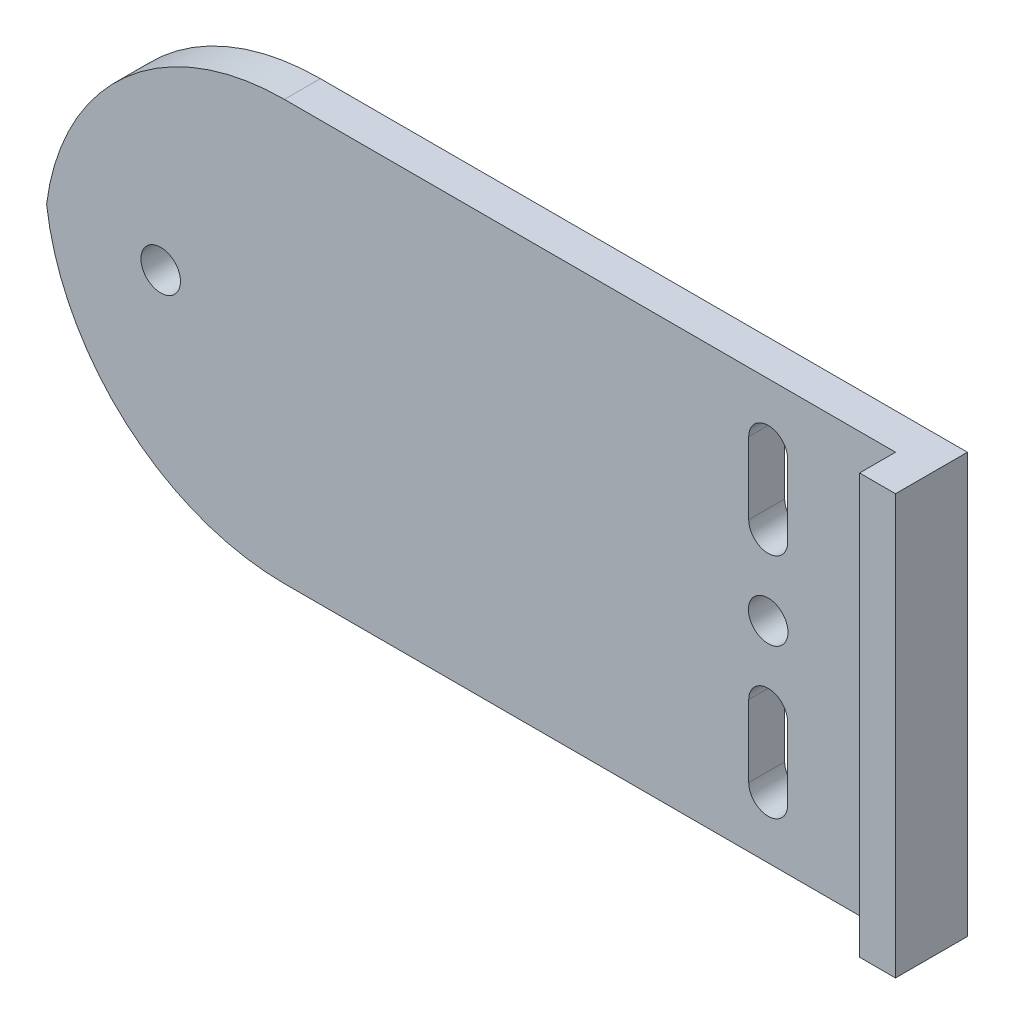
from build123d import *

# Parameters (mm, degrees)
SKETCH_1_R      = 1.65
EXTRUDE_1_DEPTH = 3
FILLET_1_R      = 20
SKETCH_4_W      = 3
SKETCH_4_H      = 35
EXTRUDE_2_DEPTH = 6


with BuildPart() as part:
    # 草图1 → 凸台-拉伸1 (new body)
    with BuildSketch(Plane.XY):
        Polygon((0, 17.5), (50, 17.5), (50, -17.5), (0, -17.5), (-24, -17.5), (-24, 17.5), align=None)
        with Locations((36.375, 0)):
            Circle(SKETCH_1_R, mode=Mode.SUBTRACT)
        with Locations((-14.32, 0)):
            Circle(SKETCH_1_R, mode=Mode.SUBTRACT)
        with BuildLine():
            Line((34.75, 12.5), (34.75, 6.5))
            ThreePointArc((34.75, 6.5), (36.375, 4.875), (38, 6.5))
            Line((38, 6.5), (38, 12.5))
            ThreePointArc((38, 12.5), (36.375, 14.125), (34.75, 12.5))
        make_face(mode=Mode.SUBTRACT)
        with BuildLine():
            Line((34.75, -6.5), (34.75, -12.5))
            ThreePointArc((34.75, -12.5), (36.375, -14.125), (38, -12.5))
            Line((38, -12.5), (38, -6.5))
            ThreePointArc((38, -6.5), (36.375, -4.875), (34.75, -6.5))
        make_face(mode=Mode.SUBTRACT)
    extrude(amount=EXTRUDE_1_DEPTH)

    # 圆角1
    # the kernel refuses this fillet: 20 mm, written as the material it takes off along each edge
    with BuildSketch(Plane(origin=(-24, -17.5, -50), x_dir=(1, 0, 0), z_dir=(0, 0, 1))) as fillet_1_piece_1:
        with BuildLine():
            CenterArc((FILLET_1_R, FILLET_1_R), FILLET_1_R, 180, 90)
            Line((0, FILLET_1_R), (0, 0))
            Line((0, 0), (FILLET_1_R, 0))
        make_face()
    extrude(amount=103, mode=Mode.SUBTRACT)
    with BuildSketch(Plane(origin=(-24, 17.5, -50), x_dir=(1, 0, 0), z_dir=(0, 0, 1))) as fillet_1_piece_2:
        with BuildLine():
            CenterArc((FILLET_1_R, -FILLET_1_R), FILLET_1_R, 90, 90)
            Line((0, -FILLET_1_R), (0, 0))
            Line((0, 0), (FILLET_1_R, 0))
        make_face()
    extrude(amount=103, mode=Mode.SUBTRACT)

    # 草图4 → 凸台-拉伸2 (add)
    with BuildSketch(Plane(origin=(0, 0, 0), x_dir=(-1, 0, 0), z_dir=(0, 0, -1))):
        with Locations((-48.5, 0)):
            Rectangle(SKETCH_4_W, SKETCH_4_H)
    extrude(amount=-EXTRUDE_2_DEPTH)


solid = part.part
